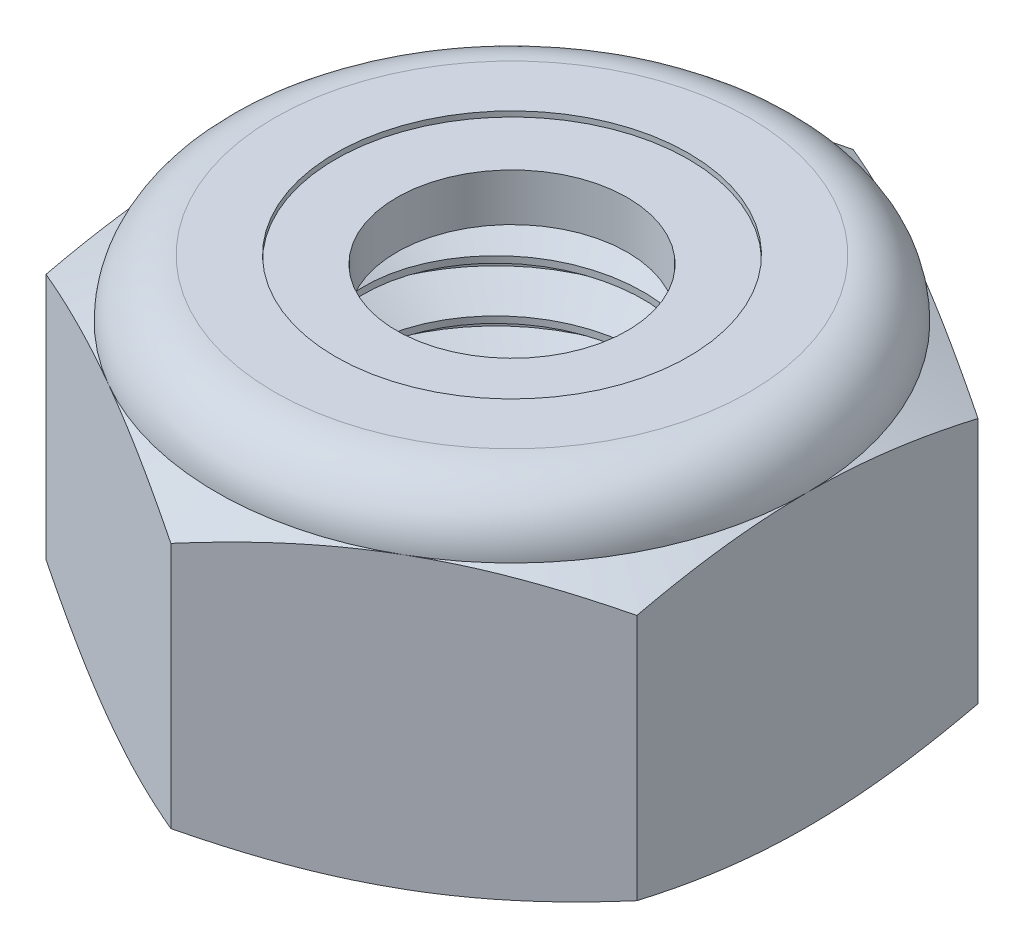
from build123d import *

# Parameters (mm, degrees)
SKETCH1_R           = 5
EXTRUDE1_DEPTH      = 10
CHAMFER1_SIZE       = 0.5
SKETCH12_R          = 5
BOSS_EXTRUDE3_DEPTH = 8.333333
SKETCH2_W           = 5
SKETCH2_H           = 9.847599999999998
CUT_SWEEP1_PITCH    = 1.5000000000000089


with BuildPart() as part:
    # Sketch1 → Extrude1 (new body)
    with BuildSketch(Plane(origin=(0, 0, 0), x_dir=(1, 0, 0), z_dir=(0, 1, 0))):
        Polygon((-2.3e-16, 9.814954576223645), (-8.500000000000004, 4.907477288111823), (-8.500000000000004, -4.907477288111818), (-3.73e-15, -9.814954576223636), (8.499999999999995, -4.907477288111823), (8.499999999999995, 4.907477288111827), align=None)
        with Locations(Location((0, 0, 0), (0, 0, 270))):
            Circle(SKETCH1_R, mode=Mode.SUBTRACT)
    extrude(amount=EXTRUDE1_DEPTH)

    # Chamfer1
    chamfer1_edges = [part.edges().sort_by_distance(p)[0] for p in [
        (1.53e-15, 0, -5),
    ]]
    chamfer(chamfer1_edges, length=CHAMFER1_SIZE)

    # Sketch5 → Cut-Revolve3 (revolve, cut)
    with BuildSketch(Plane(origin=(0, 0, 0), x_dir=(0, 0, -1), z_dir=(1, 0, 0))):
        with BuildLine():
            Line((0, 0), (8.500000000000004, 0))
            Line((8.500000000000004, 0), (9.814954576223645, 0.613173389019046))
            Line((9.814954576223645, 0.613173389019046), (9.814954576223643, 7.720159944314283))
            Line((9.814954576223643, 7.720159944314283), (8.500000000000004, 8.333333333333334))
            ThreePointArc((8.500000000000004, 8.333333333333334), (8.011844635310915, 9.511844635310911), (6.833333333333338, 9.999999999999998))
            Line((6.833333333333338, 9.999999999999998), (6.833333333333338, 11.27))
            Line((6.833333333333338, 11.27), (11.084954576223641, 11.27))
            Line((11.084954576223641, 11.27), (11.084954576223643, -1.2699999999999987))
            Line((11.084954576223643, -1.2699999999999987), (0, -1.27))
            Line((0, -1.27), (0, 0))
        make_face()
    revolve(axis=Axis((0, 0, 0), (0, 1, 0)), mode=Mode.SUBTRACT)

    # Sketch6 → Cut-Revolve4 (revolve, cut)
    with BuildSketch(Plane(origin=(0, 0, 0), x_dir=(0, 0, -1), z_dir=(1, 0, 0)), mode=Mode.PRIVATE) as cut_revolve4_sk:
        with BuildLine():
            Line((1.83e-15, 8.333333333333332), (8.347600000000003, 8.333333333333332))
            ThreePointArc((8.347600000000003, 8.333333333333332), (7.904081561858087, 9.40408156185808), (6.833333333333339, 9.847599999999998))
            Line((6.833333333333339, 9.847599999999998), (5.0762, 9.847599999999998))
            Line((5.0762, 9.847599999999998), (5.0762, 11.27))
            Line((5.0762, 11.27), (1.73e-15, 11.269999999999998))
            Line((1.73e-15, 11.269999999999998), (1.83e-15, 8.333333333333332))
        make_face()
    revolve(cut_revolve4_sk.sketch.rotate(Axis((0, 11.269999999999998, -1.73e-15), (0, -1, 8e-17)), 180), axis=Axis((0, 11.269999999999998, -1.73e-15), (0, -1, 8e-17)), mode=Mode.SUBTRACT)

    # Sketch12 → Boss-Extrude3 (add)
    with BuildSketch(Plane.XZ):
        with Locations(Location((0, 0, 0), (0, 0, 270))):
            Circle(SKETCH12_R)
    extrude(amount=-BOSS_EXTRUDE3_DEPTH)


with BuildPart() as body_2:
    # Sketch7 → Revolve2 (revolve)
    with BuildSketch(Plane(origin=(0, 0, 0), x_dir=(0, 0, -1), z_dir=(1, 0, 0))):
        with BuildLine():
            Line((3.31906666666666, 8.409533333333332), (8.26937974545858, 8.40953333333333))
            ThreePointArc((8.26937974545858, 8.40953333333333), (7.8228925932510505, 9.37679306369617), (6.833333333333338, 9.771399999999998))
            Line((6.833333333333338, 9.771399999999998), (3.31906666666666, 9.771399999999998))
            Line((3.31906666666666, 9.771399999999998), (3.31906666666666, 8.409533333333332))
        make_face()
    revolve(axis=Axis((0, 8.409533333333332, 0), (0, 1, 0)))


with BuildPart() as body_3:
    # Sketch2 → Revolve1 (revolve)
    with BuildSketch(Plane(origin=(0, 0, 0), x_dir=(0, 0, -1), z_dir=(1, 0, 0))):
        with Locations((2.5, 4.923799999999999)):
            Rectangle(SKETCH2_W, SKETCH2_H)
    revolve(axis=Axis((0, -5, 0), (0, 1, 0)))

    # Cut-Sweep1: the profile of Sketch9 profile screwed along a right-hand helix of 13.333333 turns, 8 arcs to a turn; built about Z, then put on its axis
    cut_sweep1_z = Axis((0, 0, 0), (0, 0, 1))
    cut_sweep1_corners = [(5.0003, 0, -1.312673205), (5.0003, 0, 0.000173205), (4.025721421, 0, -0.5625), (4.025721421, 0, -0.75)]
    with BuildLine(mode=Mode.PRIVATE) as cut_sweep1_profile:
        Line(cut_sweep1_corners[0], cut_sweep1_corners[1])
        Line(cut_sweep1_corners[1], cut_sweep1_corners[2])
        Line(cut_sweep1_corners[2], cut_sweep1_corners[3])
        Line(cut_sweep1_corners[3], cut_sweep1_corners[0])
    cut_sweep1_cap = Face(cut_sweep1_profile.wire())
    cut_sweep1_turn_angles = [0, 22.5, 45, 67.5, 90, 112.5, 135, 157.5, 180, 202.5, 225, 247.5, 270, 292.5, 315, 337.5, 360]
    cut_sweep1_turn_weights = [1, 0.9238795325112867, 1, 0.9238795325112867, 1, 0.9238795325112867, 1, 0.9238795325112867, 1, 0.9238795325112867, 1, 0.9238795325112867, 1, 0.9238795325112867, 1, 0.9238795325112867, 1]
    cut_sweep1_turn_rails = [Edge.make_bspline([Vector(p[0], p[1], 0).rotate(cut_sweep1_z, cut_sweep1_turn_angles[k]) / cut_sweep1_turn_weights[k] + Vector(0, 0, p[2] + CUT_SWEEP1_PITCH * cut_sweep1_turn_angles[k] / 360) for k in range(17)], [0, 0, 0, 1, 1, 2, 2, 3, 3, 4, 4, 5, 5, 6, 6, 7, 7, 8, 8, 8], 2, cut_sweep1_turn_weights) for p in cut_sweep1_corners]
    cut_sweep1_turn_sides = [Face.make_surface_from_curves(cut_sweep1_turn_rails[p[0]], cut_sweep1_turn_rails[p[1]]) for p in [(0, 1), (1, 2), (2, 3), (3, 0)]]
    cut_sweep1_last_angles = [4680, 4702.5, 4725, 4747.5, 4770, 4785, 4800]
    cut_sweep1_last_weights = [1, 0.9238795325112867, 1, 0.9238795325112867, 1, 0.9659258262890806, 1]
    cut_sweep1_last_rails = [Edge.make_bspline([Vector(p[0], p[1], 0).rotate(cut_sweep1_z, cut_sweep1_last_angles[k]) / cut_sweep1_last_weights[k] + Vector(0, 0, p[2] + CUT_SWEEP1_PITCH * cut_sweep1_last_angles[k] / 360) for k in range(7)], [0, 0, 0, 1, 1, 2, 2, 3, 3, 3], 2, cut_sweep1_last_weights) for p in cut_sweep1_corners]
    cut_sweep1_last_sides = [Face.make_surface_from_curves(cut_sweep1_last_rails[p[0]], cut_sweep1_last_rails[p[1]]) for p in [(0, 1), (1, 2), (2, 3), (3, 0)]]
    cut_sweep1 = Plane(origin=(0, 0, 0), x_dir=(0, 0, -1), z_dir=(0, 1, 0)) * Solid(Shell([*[p.moved(Location((0, 0, CUT_SWEEP1_PITCH * i))) for i in range(13) for p in cut_sweep1_turn_sides], *cut_sweep1_last_sides, cut_sweep1_cap, cut_sweep1_cap.rotate(cut_sweep1_z, 4800).moved(Location((0, 0, CUT_SWEEP1_PITCH * 4800 / 360)))]))
    add(cut_sweep1, mode=Mode.SUBTRACT)


with BuildPart() as part_1:
    add(part.part)

    # Combine1: cut body 3
    add(body_3.part, mode=Mode.SUBTRACT)

    # Sketch14 → Cut-Revolve5 (revolve, cut)
    with BuildSketch(Plane(origin=(0, 0, 0), x_dir=(0, 0, -1), z_dir=(1, 0, 0)), mode=Mode.PRIVATE) as cut_revolve5_sk:
        Polygon((-5.5, -6.7e-16), (-2.5000000000000004, 2.9999999999999676), (0, 2.9999999999999676), (0, 0), (-5, -6.1e-16), align=None)
    revolve(cut_revolve5_sk.sketch.rotate(Axis((0, 0, 0), (0, 1, 0)), 254.833591988), axis=Axis((0, 0, 0), (0, 1, 0)), mode=Mode.SUBTRACT)


solid = Compound([body_2.part, part_1.part])
